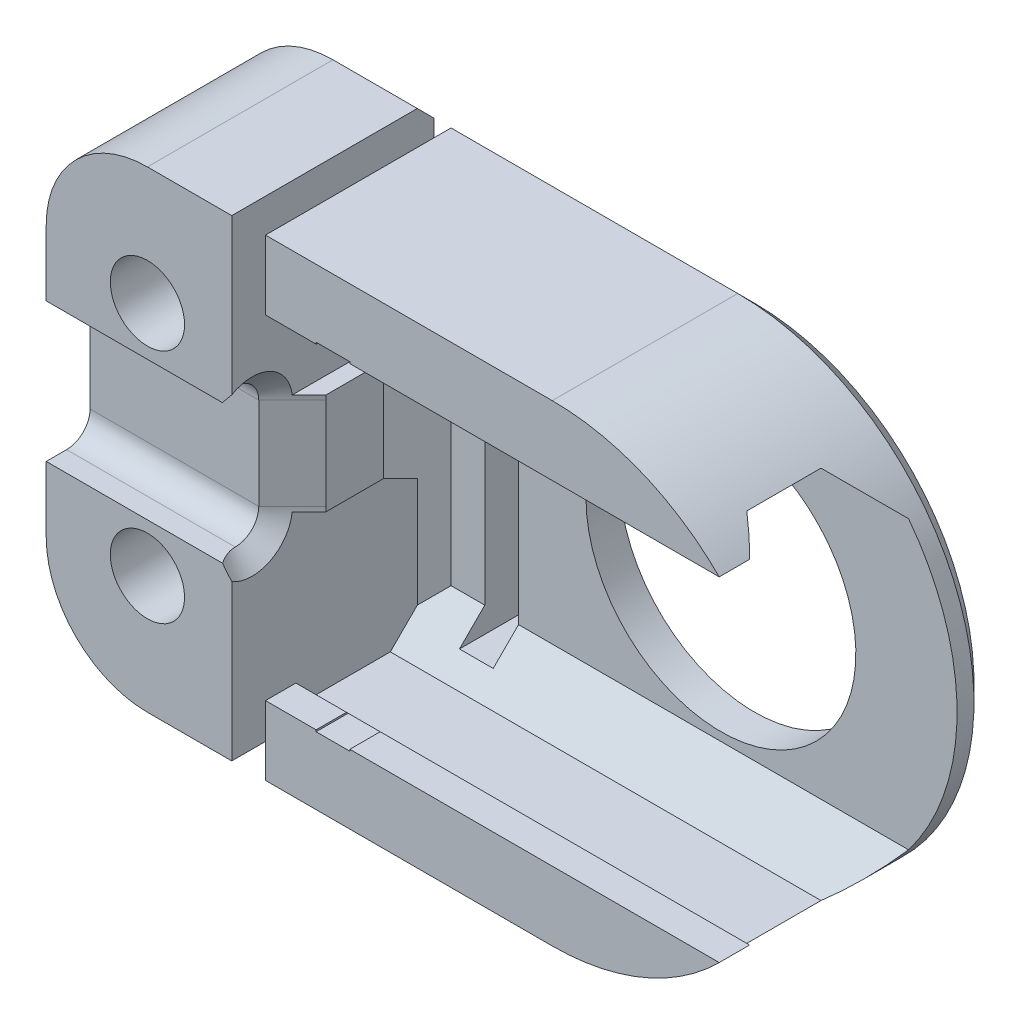
from build123d import *

# Parameters (mm, degrees)
SKETCH1_R             = 1.1
BOSS_EXTRUDE1_DEPTH   = 6
SKETCH2_R             = 4
CUT_EXTRUDE2_DEPTH    = 10
CUT_EXTRUDE4_START    = -6
CUT_EXTRUDE4_DEPTH    = 18.853720884
CUT_EXTRUDE6_DEPTH    = 24.853720884
CROQUIS1_W            = 1
CROQUIS1_H            = 5.5
CROQUIS1_H_2          = 10
CORTAR_EXTRUIR1_DEPTH = 18.606816862
FILLET4_R             = 3
FILLET1_SIZE          = 0.5
SKETCH5_R             = 1.75
CUT_EXTRUDE5_DEPTH    = 4
CHAFL_N1_SIZE         = 1


with BuildPart() as part:
    # Sketch1 → Boss-Extrude1 (new body)
    with BuildSketch(Plane.XY):
        with BuildLine():
            Line((-15, 7), (0, 7))
            ThreePointArc((0, 7), (7, 0), (0, -7))
            Line((0, -7), (-15, -7))
            Line((-15, -7), (-15, 7))
        make_face()
        with Locations((-12, 3.5)):
            Circle(SKETCH1_R, mode=Mode.SUBTRACT)
        with Locations(Location((-12, -3.5, 0), (0, 0, 180))):
            Circle(SKETCH1_R, mode=Mode.SUBTRACT)
    extrude(amount=BOSS_EXTRUDE1_DEPTH)

    # Sketch2 → Cut-Extrude2 (cut)
    with BuildSketch(Plane(origin=(0, 0, 0), x_dir=(-1, 0, 0), z_dir=(0, 0, -1))):
        Circle(SKETCH2_R)
    extrude(amount=-CUT_EXTRUDE2_DEPTH, mode=Mode.SUBTRACT)

    # Sketch7 → Cut-Extrude4 (cut, through all)
    with BuildSketch(Plane.ZY.offset(15).offset(CUT_EXTRUDE4_START)):
        Polygon((2.3, 5.55), (1, 4.25), (1, -4.25), (2.3, -5.55), (4.5, -5.55), (5.1, -4.95), (6, -4.95), (6, 4.95), (5.1, 4.95), (4.5, 5.55), align=None)
    extrude(amount=-CUT_EXTRUDE4_DEPTH, mode=Mode.SUBTRACT)

    # Sketch8 → Cut-Extrude6 (cut, through all)
    with BuildSketch(Plane.ZY.offset(15)):
        with BuildLine():
            Line((4.7, 1.363340016), (4.7, -1.363340016))
            ThreePointArc((4.7, -1.363340016), (4.904046985, -1.855953015), (5.396659984, -2.06))
            Line((5.396659984, -2.06), (6, -2.06))
            Line((6, -2.06), (6, 2.06))
            Line((6, 2.06), (5.396659984, 2.06))
            ThreePointArc((5.396659984, 2.06), (4.904046985, 1.855953015), (4.7, 1.363340016))
        make_face()
    extrude(amount=-CUT_EXTRUDE6_DEPTH, mode=Mode.SUBTRACT)

    # Croquis1 → Cortar-Extruir1 (cut, through all)
    with BuildSketch(Plane(origin=(0, 0, 0), x_dir=(-1, 0, 0), z_dir=(0, 0, -1))):
        with Locations((9, 4.25)):
            Rectangle(CROQUIS1_W, CROQUIS1_H)
        with Locations((6.5, 0)):
            Rectangle(CROQUIS1_W, CROQUIS1_H_2)
        with Locations((9, -4.25)):
            Rectangle(CROQUIS1_W, CROQUIS1_H)
    extrude(amount=-CORTAR_EXTRUIR1_DEPTH, mode=Mode.SUBTRACT)

    # Fillet4
    fillet4_edges = [part.edges().sort_by_distance(p)[0] for p in [
        (-15, -7, 3),
        (-15, 7, 3),
    ]]
    fillet(fillet4_edges, radius=FILLET4_R)

    # Fillet1
    fillet1_edges = [part.edges().sort_by_distance(p)[0] for p in [
        (-4.25, -7, 0),
        (-10.75, 7, 0),
        (-15, 0, 0),
        (-10.75, -7, 0),
        (-14.121320344, -6.121320344, 0),
        (-14.121320344, 6.121320344, 0),
        (-4.25, 7, 0),
        (7, 0, 0),
    ]]
    chamfer(fillet1_edges, length=FILLET1_SIZE)

    # Sketch5 → Cut-Extrude5 (cut)
    with BuildSketch(Plane.XY):
        with Locations((-12, 3.5)):
            Circle(SKETCH5_R)
        with Locations((-12, -3.5)):
            Circle(SKETCH5_R)
    extrude(amount=CUT_EXTRUDE5_DEPTH, mode=Mode.SUBTRACT)

    # Chaflán1
    chafl_n1_edges = [part.edges().sort_by_distance(p)[0] for p in [
        (-9, 0, 1),
    ]]
    chamfer(chafl_n1_edges, length=CHAFL_N1_SIZE)
    # the kernel refuses this chamfer: 1 mm, written as the material it takes off along each edge
    with BuildSketch(Plane(origin=(-9, 1.363340016, 4.7), x_dir=(0, 0, -1), z_dir=(0, -1, 0))) as chafl_n1_2_piece_1:
        with BuildLine():
            Line((1.028284271, 0.028284271), (-0.028284271, -1.028284271))
            Line((-0.028284271, -1.028284271), (-0.048284271, -1.028284271))
            ThreePointArc((-0.048284271, -1.028284271), (-0.02, -0.514142136), (-0.02, 0))
            Line((-0.02, 0), (0, 0.02))
            ThreePointArc((0, 0.02), (0.514142136, 0.02), (1.028284271, 0.048284271))
            Line((1.028284271, 0.048284271), (1.028284271, 0.028284271))
        make_face()
    extrude(amount=2.726680031, mode=Mode.SUBTRACT)
    with BuildSketch(Plane(origin=(-9, 1.363340016, 5.396659984), x_dir=(0, -0.6796769184207155, 0.7335116131092404), z_dir=(0, -0.7335116131092404, -0.6796769184207155))) as chafl_n1_2_piece_2:
        with BuildLine():
            Line((1.724944256, -0.028284271), (0.668375713, 1.028284271))
            Line((0.668375713, 1.028284271), (0.648375713, 1.028284271))
            ThreePointArc((0.648375713, 1.028284271), (0.676659984, 0.514142136), (0.676659984, 0))
            Line((0.676659984, 0), (0.696659984, -0.02))
            ThreePointArc((0.696659984, -0.02), (1.21080212, -0.02), (1.724944256, -0.048284271))
            Line((1.724944256, -0.048284271), (1.724944256, -0.028284271))
        make_face()
    revolve(axis=Axis((-9, 1.363340016, 5.396659984), (-1, 0, 0)), revolution_arc=222.818401466, mode=Mode.SUBTRACT)
    with BuildSketch(Plane(origin=(-9, -1.363340016, 5.396659984), x_dir=(0, 0, -1), z_dir=(0, 1, 0))) as chafl_n1_2_piece_3:
        with BuildLine():
            Line((1.724944256, -0.028284271), (0.668375713, 1.028284271))
            Line((0.668375713, 1.028284271), (0.648375713, 1.028284271))
            ThreePointArc((0.648375713, 1.028284271), (0.676659984, 0.514142136), (0.676659984, 0))
            Line((0.676659984, 0), (0.696659984, -0.02))
            ThreePointArc((0.696659984, -0.02), (1.21080212, -0.02), (1.724944256, -0.048284271))
            Line((1.724944256, -0.048284271), (1.724944256, -0.028284271))
        make_face()
    revolve(axis=Axis((-9, -1.363340016, 5.396659984), (-1, 0, 0)), revolution_arc=222.818401466, mode=Mode.SUBTRACT)


solid = part.part
